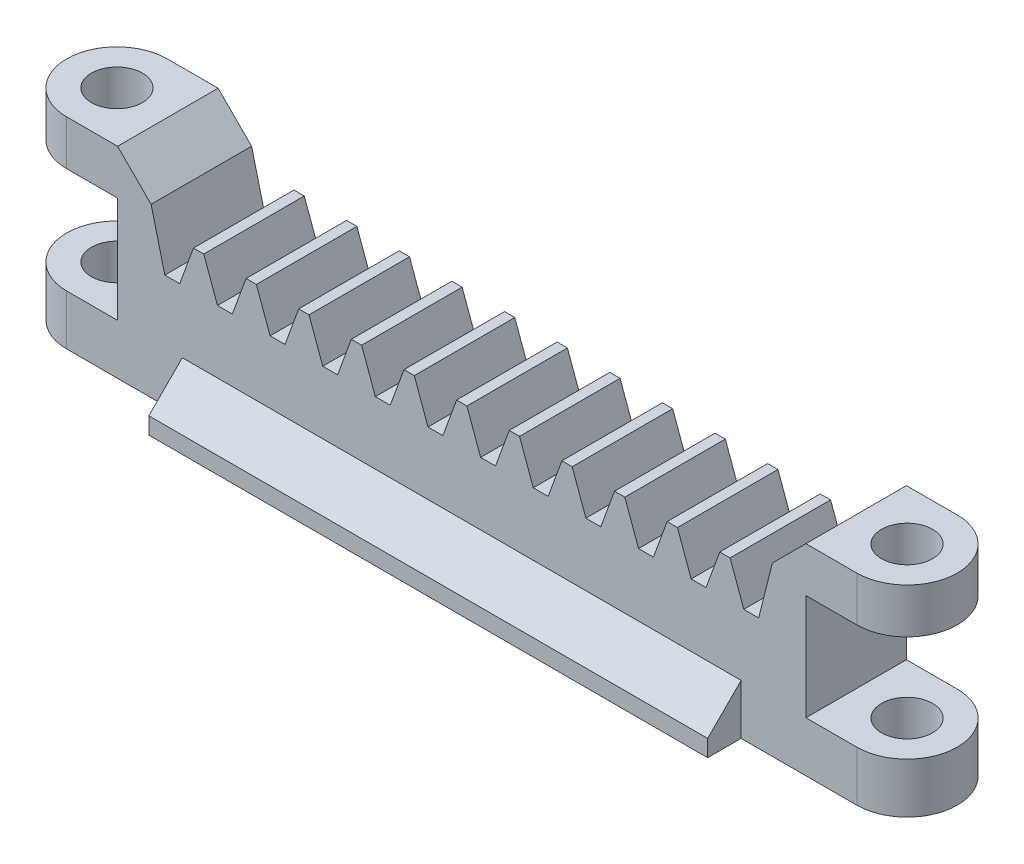
from build123d import *
from build123d.topology import SkipClean

# Parameters (mm, degrees)
BOSS_EXTRUDE1_DEPTH  = 6
SKETCH2_W            = 6
SKETCH2_H            = 6
SKETCH2_R            = 1.525
BOSS_EXTRUDE2_DEPTH  = 3.75
FILLET1_R            = 3
SKETCH4_W            = 33.355842528
SKETCH4_H            = 6
BOSS_EXTRUDE3_DEPTH  = 3
BOSS_EXTRUDE4_DEPTH  = 33.355842528
BOSS_EXTRUDE5_START  = -6.75
SKETCH7_R            = 1.525
BOSS_EXTRUDE5_DEPTH  = 12
SKETCH8_W            = 6
SKETCH8_H            = 5.25
BOSS_EXTRUDE6_DEPTH  = 1.433789
BOSS_EXTRUDE7_REACH  = 51.468
SKETCH11_W           = 6
SKETCH11_H           = 3
MIRROR1_START        = -14.24613882
MIRROR1_OUTLINE_R    = 1.525
MIRROR1_DEPTH        = 12
SKETCH13_W           = 6
SKETCH13_H           = 5.25
BOSS_EXTRUDE8_DEPTH  = 1.434493
BOSS_EXTRUDE9_REACH  = 51.468
SKETCH14_W           = 6
SKETCH14_H           = 3
CHAMFER1_SIZE        = 2
SKETCH15_W           = 7.967920834
SKETCH15_H           = 6.3175
CUT_EXTRUDE1_DEPTH   = 6.25
BOSS_EXTRUDE10_DEPTH = 6


# Read off the part's stored shape, not the designer's step: Mirror1
# Some blends are built 0.0001 mm under size
with BuildPart() as part:
    # Sketch1 → Boss-Extrude1 (new body)
    with BuildSketch(Plane(origin=(0, 0, 0.755649514), x_dir=(-1, 0, 0), z_dir=(0, 0, -1))):
        Polygon((31.089725273, -5.24613882), (30.270792245, -7.49613882), (29.667061326, -7.49613882), (29.667061326, -11.24613882), (70.667061326, -11.24613882), (70.827061326, -11.24613882), (70.827061326, -7.49613882), (70.667061326, -7.49613882), (70.222625956, -7.49613882), (69.403692929, -5.24613882), (68.788837073, -5.24613882), (67.969904045, -7.49613882), (67.081033306, -7.49613882), (66.262100279, -5.24613882), (65.647244423, -5.24613882), (64.828311395, -7.49613882), (63.939440656, -7.49613882), (63.120507629, -5.24613882), (62.505651773, -5.24613882), (61.686718745, -7.49613882), (60.797848006, -7.49613882), (59.978914979, -5.24613882), (59.364059123, -5.24613882), (58.545126095, -7.49613882), (57.656255356, -7.49613882), (56.837322329, -5.24613882), (56.222466473, -5.24613882), (55.403533445, -7.49613882), (54.514662706, -7.49613882), (53.695729679, -5.24613882), (53.080873823, -5.24613882), (52.261940795, -7.49613882), (51.373070056, -7.49613882), (50.554137029, -5.24613882), (49.939281173, -5.24613882), (49.120348145, -7.49613882), (48.231477406, -7.49613882), (47.412544379, -5.24613882), (46.797688523, -5.24613882), (45.978755495, -7.49613882), (45.089884756, -7.49613882), (44.270951729, -5.24613882), (43.656095873, -5.24613882), (42.837162845, -7.49613882), (41.948292106, -7.49613882), (41.129359079, -5.24613882), (40.514503223, -5.24613882), (39.695570195, -7.49613882), (38.806699456, -7.49613882), (37.987766429, -5.24613882), (37.372910573, -5.24613882), (36.553977545, -7.49613882), (35.665106806, -7.49613882), (34.846173779, -5.24613882), (34.231317923, -5.24613882), (33.412384895, -7.49613882), (32.523514156, -7.49613882), (31.704581129, -5.24613882), align=None)
    extrude(amount=-BOSS_EXTRUDE1_DEPTH)

    # Sketch2 → Boss-Extrude2 (add)
    # profile 1 of 2: a face of its own
    with BuildSketch(Plane.XZ.offset(11.24613882)):
        with Locations((-73.827061326, 3.755649514)):
            Rectangle(SKETCH2_W, SKETCH2_H)
        with Locations(Location((-73.827061326, 3.755649514, 0), (0, 0, 270))):
            Circle(SKETCH2_R, mode=Mode.SUBTRACT)
    # profile 2 of 2: a face of its own
    with BuildSketch(Plane.XZ.offset(11.24613882)):
        with Locations((-26.667061326, 3.755649514)):
            Rectangle(SKETCH2_W, SKETCH2_H)
        with Locations(Location((-26.667061326, 3.755649514, 0), (0, 0, 270))):
            Circle(SKETCH2_R, mode=Mode.SUBTRACT)
    extrude(amount=-BOSS_EXTRUDE2_DEPTH)

    # Fillet1
    fillet1_edges = [part.edges().sort_by_distance(p)[0] for p in [
        (-23.667061326, -9.37113882, 0.755649514),
        (-23.667061326, -9.37113882, 6.755649514),
        (-76.827061326, -9.37113882, 6.755649514),
        (-76.827061326, -9.37113882, 0.755649514),
    ]]
    fillet(fillet1_edges, radius=FILLET1_R - 0.0001)  # a hair under: the kernel refuses the full size

    # Sketch4 → Boss-Extrude3 (add)
    with BuildSketch(Plane.XZ.offset(11.24613882)):
        with Locations((-50.247061326, 3.755649514)):
            Rectangle(SKETCH4_W, SKETCH4_H)
    extrude(amount=BOSS_EXTRUDE3_DEPTH)

    # Sketch5 → Boss-Extrude4 (add)
    with BuildSketch(Plane.ZY.offset(66.92498259)):
        Polygon((0.755649514, -11.24613882), (-1.244350486, -13.24613882), (-1.244350486, -14.24613882), (0.755649514, -14.24613882), align=None)
        Polygon((8.755649514, -13.24613882), (8.755649514, -14.24613882), (6.755649514, -14.24613882), (6.755649514, -11.24613882), align=None)
    extrude(amount=-BOSS_EXTRUDE4_DEPTH)

    # Sketch7 → Boss-Extrude5 (add)
    with BuildSketch(Plane(origin=(0, -7.49613882, 0), x_dir=(1, 0, 0), z_dir=(0, 1, 0)).offset(BOSS_EXTRUDE5_START)):
        with BuildLine():
            Line((-26.667061326, -0.755649514), (-30.270792245, -0.755649514))
            Line((-30.270792245, -0.755649514), (-30.270792245, -6.755649514))
            Line((-30.270792245, -6.755649514), (-26.667061326, -6.755649514))
            ThreePointArc((-26.667061326, -6.755649514), (-24.545740982, -5.876969858), (-23.667061326, -3.755649514))
            ThreePointArc((-23.667061326, -3.755649514), (-24.545740982, -1.634329171), (-26.667061326, -0.755649514))
        make_face()
        with Locations(Location((-26.667061326, -3.755649514, 0), (0, 0, 270))):
            Circle(SKETCH7_R, mode=Mode.SUBTRACT)
    extrude(amount=BOSS_EXTRUDE5_DEPTH)

    # Sketch8 → Boss-Extrude6 (add)
    with BuildSketch(Plane.ZY.offset(30.270792245)):
        with Locations((3.755649514, -4.87113882)):
            Rectangle(SKETCH8_W, SKETCH8_H)
    extrude(amount=BOSS_EXTRUDE6_DEPTH)

    # Sketch11 → Boss-Extrude7 (add, up to next)
    with BuildSketch(Plane.ZY.offset(30.270792245), mode=Mode.PRIVATE) as boss_extrude7_sk1:
        with Locations((3.755649514, -12.74613882)):
            Rectangle(SKETCH11_W, SKETCH11_H)
    boss_extrude7_tool1 = extrude(boss_extrude7_sk1.sketch, amount=BOSS_EXTRUDE7_REACH, mode=Mode.PRIVATE) - part.part
    add(boss_extrude7_tool1.solids().sort_by_distance((-30.270792, -12.746139, 3.75565))[0])

    # Mirror1 outline → Mirror1 (add)
    with SkipClean():  # the faces are left unmerged after this step: merging them gives an invalid solid
        with BuildSketch(Plane(origin=(0, 0, 0), x_dir=(1, 0, 0), z_dir=(0, 1, 0)).offset(MIRROR1_START)):
            with BuildLine():
                ThreePointArc((-73.827061326, -0.755649514), (-76.827061326, -3.755649514), (-73.827061326, -6.755649514))
                Line((-73.827061326, -6.755649514), (-70.223330406, -6.755649514))
                Line((-70.223330406, -6.755649514), (-70.223330406, -0.755649514))
                Line((-70.223330406, -0.755649514), (-73.827061326, -0.755649514))
            make_face()
            with Locations((-73.827061326, -3.755649514)):
                Circle(MIRROR1_OUTLINE_R, mode=Mode.SUBTRACT)
        extrude(amount=MIRROR1_DEPTH)

    # Sketch13 → Boss-Extrude8 (add)
    with SkipClean():  # the faces are left unmerged after this step: merging them gives an invalid solid
        with BuildSketch(Plane(origin=(-70.223330406, 0, 0), x_dir=(0, 0, -1), z_dir=(1, 0, 0))):
            with Locations((-3.755649514, -4.87113882)):
                Rectangle(SKETCH13_W, SKETCH13_H)
        extrude(amount=BOSS_EXTRUDE8_DEPTH)

    # Sketch14 → Boss-Extrude9 (add, up to next)
    with BuildSketch(Plane(origin=(-70.223330406, 0, 0), x_dir=(0, 0, -1), z_dir=(1, 0, 0)), mode=Mode.PRIVATE) as boss_extrude9_sk1:
        with Locations((-3.755649514, -12.74613882)):
            Rectangle(SKETCH14_W, SKETCH14_H)
    boss_extrude9_tool1 = extrude(boss_extrude9_sk1.sketch, amount=BOSS_EXTRUDE9_REACH, mode=Mode.PRIVATE) - part.part
    add(boss_extrude9_tool1.solids().sort_by_distance((-70.22333, -12.746139, 3.75565))[0])

    # Chamfer1
    # the kernel refuses this chamfer: 2 mm, written as the material it takes off along each edge
    with BuildSketch(Plane(origin=(-31.704581245, -2.24613882, 11.89901549), x_dir=(0.9996219169112968, 0.027495876610586296, 0), z_dir=(0, 0, -1))) as chamfer1_piece_1:
        Polygon((CHAMFER1_SIZE * 0.999621916911, CHAMFER1_SIZE * 0.0274958766106), (-CHAMFER1_SIZE * 0.0274958766106, CHAMFER1_SIZE * 0.999621916911), (0, 0), align=None)
    extrude(amount=16.286731952, mode=Mode.SUBTRACT)
    with BuildSketch(Plane(origin=(-68.788837406, -2.24613882, -4.387716461), x_dir=(0.027495876610589064, -0.9996219169112965, 0), z_dir=(0, 0, 1))) as chamfer1_piece_2:
        Polygon((CHAMFER1_SIZE * 0.999621916911, -CHAMFER1_SIZE * 0.0274958766106), (-CHAMFER1_SIZE * 0.0274958766106, -CHAMFER1_SIZE * 0.999621916911), (0, 0), align=None)
    extrude(amount=16.286731952, mode=Mode.SUBTRACT)

    # Sketch15 → Cut-Extrude1 (cut)
    with BuildSketch(Plane(origin=(0, 0, 0.755649514), x_dir=(-1, 0, 0), z_dir=(0, 0, -1))):
        with Locations((25.720620712, -8.08738882)):
            Rectangle(SKETCH15_W, SKETCH15_H)
    cut_extrude1 = extrude(amount=-CUT_EXTRUDE1_DEPTH, mode=Mode.SUBTRACT)

    # Mirror2: Cut-Extrude1 across plane
    add(cut_extrude1.mirror(Plane(origin=(-50.247061326, 0, 0), x_dir=(0, 0, 1), z_dir=(1, 0, 0))), mode=Mode.SUBTRACT)

    # Sketch16 → Boss-Extrude10 (add)
    with BuildSketch(Plane(origin=(0, 0, 0.755649514), x_dir=(-1, 0, 0), z_dir=(0, 0, -1))):
        Polygon((67.969904045, -7.49613882), (68.788837073, -4.24613882), (68.788837073, -7.702493067), align=None)
        Polygon((31.704581129, -4.24613882), (32.523514156, -7.49613882), (31.704581129, -7.702493067), align=None)
    extrude(amount=-BOSS_EXTRUDE10_DEPTH)


solid = part.part
